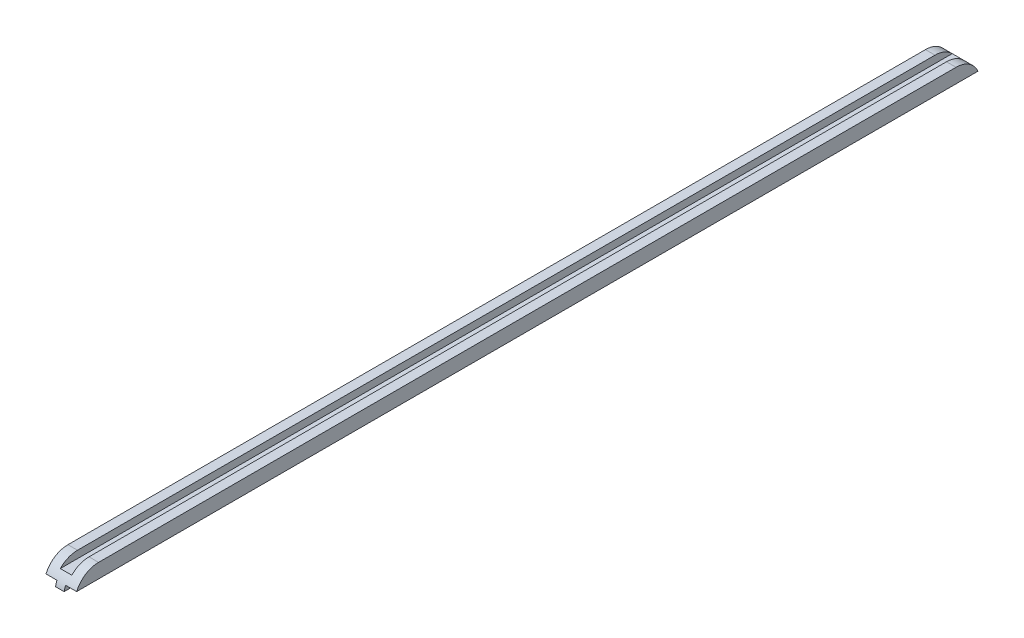
from build123d import *

# Parameters (mm, degrees)
BOSS_EXTRUDE1_DEPTH = 189
SKETCH3_W           = 1.8
SKETCH3_H           = 1
BOSS_EXTRUDE2_DEPTH = 189
FILLET1_START       = -4
FILLET1_DEPTH       = 9


with BuildPart() as part:
    # Sketch1 → Boss-Extrude1 (new body)
    with BuildSketch(Plane.XY):
        Polygon((-2.657407407, 0), (3.742592593, 0), (3.742592593, 3), (1.742592593, 3), (1.742592593, 1.476851852), (-0.657407407, 1.476851852), (-0.657407407, 3), (-2.657407407, 3), align=None)
    extrude(amount=BOSS_EXTRUDE1_DEPTH)

    # Sketch3 → Boss-Extrude2 (add)
    with BuildSketch(Plane.XY.offset(189)):
        with Locations((0.542592593, -0.5)):
            Rectangle(SKETCH3_W, SKETCH3_H)
    extrude(amount=-BOSS_EXTRUDE2_DEPTH)

    # Fillet1: read off the stored shape, not the designer's step
    # Fillet1 outline → Fillet1 (cut)
    with BuildSketch(Plane.YZ.offset(FILLET1_START)):
        with BuildLine():
            Line((-1, 0), (3, 0))
            Line((3, 0), (3, 4.898979486))
            ThreePointArc((3, 4.898979486), (1.872983346, 1.736701826), (-1, 0))
        make_face()
        with BuildLine():
            ThreePointArc((-1, 189), (1.872983346, 187.263298174), (3, 184.101020514))
            Line((3, 184.101020514), (3, 189))
            Line((3, 189), (-1, 189))
        make_face()
    extrude(amount=FILLET1_DEPTH, mode=Mode.SUBTRACT)


solid = part.part
